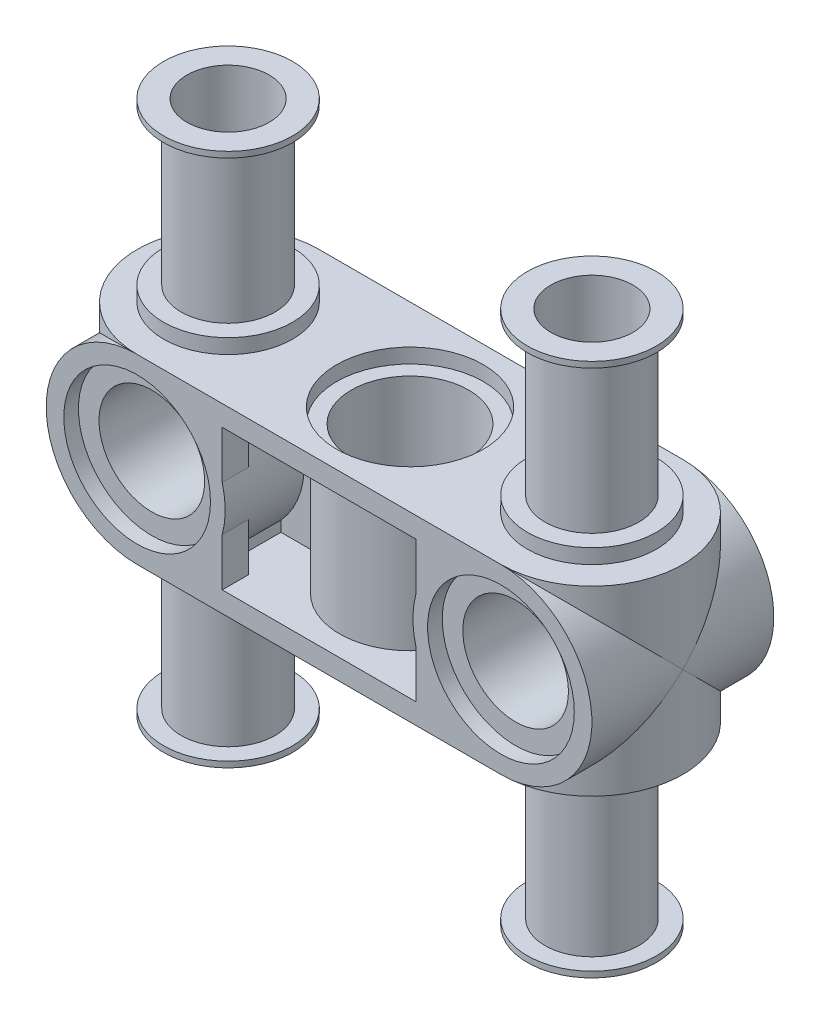
from build123d import *
from build123d.topology import SkipClean

# Parameters (mm, degrees)
EXTRUDE1_DEPTH     = 3.937
SKETCH2_R          = 2.794
CUT_EXTRUDE1_DEPTH = 0.254
SKETCH3_R          = 2.794
EXTRUDE2_DEPTH     = 0.635
SKETCH5_R          = 2.032
SKETCH5_R_2        = 1.778
EXTRUDE4_DEPTH     = 6.985
EXTRUDE5_START     = -0.254
SKETCH6_R          = 2.794
SKETCH6_R_2        = 1.778
EXTRUDE5_DEPTH     = 0.254
EXTRUDE6_DEPTH     = 7.874
SKETCH8_R          = 2.54
CUT_EXTRUDE2_DEPTH = 3.556
SKETCH9_R          = 2.286
CUT_EXTRUDE3_DEPTH = 17.110989945
SKETCH10_R         = 3.175
CUT_EXTRUDE4_DEPTH = 0.635
CUT_EXTRUDE6_DEPTH = 3.048
SKETCH13_R         = 2.54
CUT_EXTRUDE7_DEPTH = 15.799178727
SKETCH14_R         = 3.175
CUT_EXTRUDE8_DEPTH = 0.635
EXTRUDE8_DEPTH     = 7.112


with BuildPart() as part:
    # Sketch1 → Extrude1 (new body)
    with BuildSketch(Plane(origin=(0, 0, 0), x_dir=(1, 0, 0), z_dir=(0, 1, 0))):
        with BuildLine():
            Line((-7.874, 3.937), (7.874, 3.937))
            ThreePointArc((7.874, 3.937), (11.811, 0), (7.874, -3.937))
            Line((7.874, -3.937), (-7.874, -3.937))
            ThreePointArc((-7.874, -3.937), (-11.811, 0), (-7.874, 3.937))
        make_face()
    extrude(amount=EXTRUDE1_DEPTH)

    # Sketch2 → Cut-Extrude1 (cut)
    with BuildSketch(Plane.XZ):
        Circle(SKETCH2_R)
    extrude(amount=-CUT_EXTRUDE1_DEPTH, mode=Mode.SUBTRACT)

    # Sketch3 → Extrude2 (add)
    with BuildSketch(Plane.XZ):
        with Locations((7.874, 0)):
            Circle(SKETCH3_R)
        with Locations((-7.874, 0)):
            Circle(SKETCH3_R)
    extrude(amount=EXTRUDE2_DEPTH)

    # Sketch5 → Extrude4 (add)
    # profile 1 of 2: a face of its own
    with BuildSketch(Plane.XZ.offset(0.635)):
        with Locations((7.874, 0)):
            Circle(SKETCH5_R)
        with Locations((7.874, 0)):
            Circle(SKETCH5_R_2, mode=Mode.SUBTRACT)
    # profile 2 of 2: a face of its own
    with BuildSketch(Plane.XZ.offset(0.635)):
        with Locations((-7.874, 0)):
            Circle(SKETCH5_R)
        with Locations((-7.874, 0)):
            Circle(SKETCH5_R_2, mode=Mode.SUBTRACT)
    extrude(amount=EXTRUDE4_DEPTH)

    # Sketch6 → Extrude5 (add)
    # profile 1 of 2: a face of its own
    with BuildSketch(Plane.XZ.offset(7.62).offset(EXTRUDE5_START)):
        with Locations((-7.874, 0)):
            Circle(SKETCH6_R)
        with Locations((-7.874, 0)):
            Circle(SKETCH6_R_2, mode=Mode.SUBTRACT)
    # profile 2 of 2: a face of its own
    with BuildSketch(Plane.XZ.offset(7.62).offset(EXTRUDE5_START)):
        with Locations((7.874, 0)):
            Circle(SKETCH6_R)
        with Locations((7.874, 0)):
            Circle(SKETCH6_R_2, mode=Mode.SUBTRACT)
    extrude(amount=EXTRUDE5_DEPTH)

    # Sketch7 → Extrude6 (add)
    with BuildSketch(Plane(origin=(0, 0, -3.937), x_dir=(-1, 0, 0), z_dir=(0, 0, -1))):
        with BuildLine():
            Line((-7.874, 0), (7.874, 0))
            ThreePointArc((7.874, 0), (10.657879398, 1.153120602), (11.811, 3.937))
            Line((11.811, 3.937), (7.874, 3.937))
            Line((7.874, 3.937), (-7.874, 3.937))
            Line((-7.874, 3.937), (-11.811, 3.937))
            ThreePointArc((-11.811, 3.937), (-10.657879398, 1.153120602), (-7.874, 0))
        make_face()
    extrude(amount=-EXTRUDE6_DEPTH)

    # Sketch8 → Cut-Extrude2 (cut)
    with BuildSketch(Plane(origin=(0, 3.937, 0), x_dir=(1, 0, 0), z_dir=(0, 1, 0))):
        Circle(SKETCH8_R)
    extrude(amount=-CUT_EXTRUDE2_DEPTH, mode=Mode.SUBTRACT)

    # Sketch9 → Cut-Extrude3 (cut, through all)
    with BuildSketch(Plane.XY.offset(3.937)):
        with Locations((7.874, 3.937)):
            Circle(SKETCH9_R)
        with Locations((-7.874, 3.937)):
            Circle(SKETCH9_R)
    extrude(amount=-CUT_EXTRUDE3_DEPTH, mode=Mode.SUBTRACT)

    # Sketch10 → Cut-Extrude4 (cut)
    with BuildSketch(Plane.XY.offset(3.937)):
        with Locations((7.874, 3.937)):
            Circle(SKETCH10_R)
        with Locations((-7.874, 3.937)):
            Circle(SKETCH10_R)
    cut_extrude4 = extrude(amount=-CUT_EXTRUDE4_DEPTH, mode=Mode.SUBTRACT)

    # Mirror2: Cut-Extrude4 across plane
    add(cut_extrude4.mirror(Plane.XY), mode=Mode.SUBTRACT)

    # Sketch11 → Cut-Extrude6 (cut)
    with BuildSketch(Plane(origin=(0, 3.937, 0), x_dir=(1, 0, 0), z_dir=(0, 1, 0))):
        with BuildLine():
            Line((-5.08, -0.508), (-5.08, -2.794))
            Line((-5.08, -2.794), (-4.191, -2.794))
            Line((-4.191, -2.794), (-4.191, -3.937))
            Line((-4.191, -3.937), (4.191, -3.937))
            Line((4.191, -3.937), (4.191, -2.794))
            Line((4.191, -2.794), (5.08, -2.794))
            Line((5.08, -2.794), (5.08, -0.508))
            Line((5.08, -0.508), (3.00536853, -0.508))
            ThreePointArc((3.00536853, -0.508), (0, -3.048), (-3.00536853, -0.508))
            Line((-3.00536853, -0.508), (-5.08, -0.508))
        make_face()
        with BuildLine():
            Line((5.08, 0.508), (5.08, 2.794))
            Line((5.08, 2.794), (4.191, 2.794))
            Line((4.191, 2.794), (4.191, 3.937))
            Line((4.191, 3.937), (-4.191, 3.937))
            Line((-4.191, 3.937), (-4.191, 2.794))
            Line((-4.191, 2.794), (-5.08, 2.794))
            Line((-5.08, 2.794), (-5.08, 0.508))
            Line((-5.08, 0.508), (-3.00536853, 0.508))
            ThreePointArc((-3.00536853, 0.508), (0, 3.048), (3.00536853, 0.508))
            Line((3.00536853, 0.508), (5.08, 0.508))
        make_face()
    extrude(amount=-CUT_EXTRUDE6_DEPTH, mode=Mode.SUBTRACT)

    # Sketch13 → Cut-Extrude7 (cut, through all)
    with BuildSketch(Plane(origin=(0, 0.381, 0), x_dir=(1, 0, 0), z_dir=(0, 1, 0))):
        Circle(SKETCH13_R)
    extrude(amount=-CUT_EXTRUDE7_DEPTH, mode=Mode.SUBTRACT)

    # Sketch14 → Cut-Extrude8 (cut)
    with BuildSketch(Plane.XZ):
        Circle(SKETCH14_R)
    extrude(amount=-CUT_EXTRUDE8_DEPTH, mode=Mode.SUBTRACT)

    # Sketch17 → Extrude8 (add)
    with BuildSketch(Plane.XY.offset(3.937)):
        with BuildLine():
            Line((-4.064, 3.937), (-4.699, 3.937))
            ThreePointArc((-4.699, 3.937), (-7.874, 0.762), (-11.049, 3.937))
            Line((-11.049, 3.937), (-11.684, 3.937))
            ThreePointArc((-11.684, 3.937), (-7.874, 0.127), (-4.064, 3.937))
        make_face()
    extrude8 = extrude(amount=-EXTRUDE8_DEPTH)

    # Mirror3: Extrude8 across plane
    add(extrude8.mirror(Plane(origin=(0, 0, 0), x_dir=(0, 0, 1), z_dir=(1, 0, 0))))

    # Mirror1: part across plane


with BuildPart() as part_1:
    with SkipClean():  # the faces are left unmerged after this step: merging them gives an invalid solid
        add(part.part)
        add(part.part.mirror(Plane(origin=(-7.874, 3.937, 0), x_dir=(0, 0, 1), z_dir=(0, 1, 0))))


solid = part_1.part
